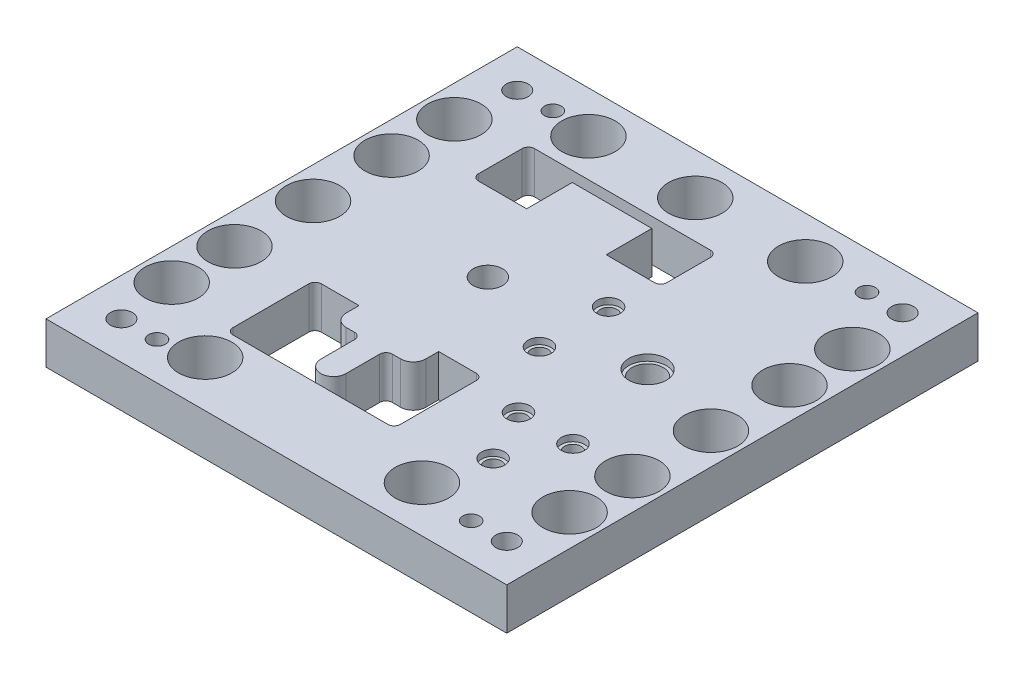
from build123d import *

# Parameters (mm, degrees)
SKETCH1_W                                    = 220
SKETCH1_H                                    = 225
BOSS_EXTRUDE1_DEPTH                          = 20
CUT_EXTRUDE3_REACH                           = 160.607
CUT_EXTRUDE4_REACH                           = 160.607
CUT_EXTRUDE5_REACH                           = 160.607
SKETCH7_R                                    = 4
CUT_EXTRUDE6_REACH                           = 160.607
SKETCH9_R                                    = 7.5
SKETCH10_R                                   = 5.5
CUT_EXTRUDE7_DEPTH                           = 3
SKETCH11_R                                   = 9
CUT_EXTRUDE8_DEPTH                           = 3
CBORE_FOR_M10_HEX_SOCKET_HEAD_CAP_SC_2_COUNT = 2
CBORE_FOR_M10_HEX_SOCKET_HEAD_CAP_SC_2_PITCH = 184
CBORE_FOR_M10_HEX_SOCKET_HEAD_CAP_SC_3_COUNT = 2
CBORE_FOR_M10_HEX_SOCKET_HEAD_CAP_SC_3_PITCH = 263.774524926
CBORE_FOR_M10_HEX_SOCKET_HEAD_CAP_SC_4_COUNT = 2
CBORE_FOR_M10_HEX_SOCKET_HEAD_CAP_SC_4_PITCH = 189
F_8_0MM_DOWEL_HOLE1_D                        = 8
F_25_5_25_5_DIAMETER_HOLE1_D                 = 25.5
CUT_EXTRUDE9_REACH                           = 160.607
SKETCH26_R                                   = 7


with BuildPart() as part:
    # Sketch1 → Boss-Extrude1 (new body)
    with BuildSketch(Plane(origin=(0, 0, 0), x_dir=(1, 0, 0), z_dir=(0, 1, 0))):
        Rectangle(SKETCH1_W, SKETCH1_H)
    extrude(amount=-BOSS_EXTRUDE1_DEPTH)

    # Sketch5 → Cut-Extrude3 (cut, up to next)
    with BuildSketch(Plane(origin=(0, 0, 0), x_dir=(1, 0, 0), z_dir=(0, 1, 0)), mode=Mode.PRIVATE) as cut_extrude3_sk1:
        with BuildLine():
            Line((-2.75, -38.4), (-2.75, -32.27))
            Line((-2.75, -32.27), (15.25, -32.27))
            ThreePointArc((15.25, -32.27), (17.371320344, -33.148679656), (18.25, -35.27))
            Line((18.25, -35.27), (18.25, -71.53))
            ThreePointArc((18.25, -71.53), (17.371320344, -73.651320344), (15.25, -74.53))
            Line((15.25, -74.53), (-58.75, -74.53))
            ThreePointArc((-58.75, -74.53), (-60.871320344, -73.651320344), (-61.75, -71.53))
            Line((-61.75, -71.53), (-61.75, -35.27))
            ThreePointArc((-61.75, -35.27), (-60.871320344, -33.148679656), (-58.75, -32.27))
            Line((-58.75, -32.27), (-40.75, -32.27))
            Line((-40.75, -32.27), (-40.75, -38.4))
            ThreePointArc((-40.75, -38.4), (-38.992640687, -42.642640687), (-34.75, -44.4))
            Line((-34.75, -44.4), (-30.75, -44.4))
            ThreePointArc((-30.75, -44.4), (-28.628679656, -45.278679656), (-27.75, -47.4))
            Line((-27.75, -47.4), (-27.75, -63.53))
            ThreePointArc((-27.75, -63.53), (-21.75, -69.53), (-15.75, -63.53))
            Line((-15.75, -63.53), (-15.75, -47.4))
            ThreePointArc((-15.75, -47.4), (-14.871320344, -45.278679656), (-12.75, -44.4))
            Line((-12.75, -44.4), (-8.75, -44.4))
            ThreePointArc((-8.75, -44.4), (-4.507359313, -42.642640687), (-2.75, -38.4))
        make_face()
    cut_extrude3_tool1 = extrude(cut_extrude3_sk1.sketch, amount=-CUT_EXTRUDE3_REACH, mode=Mode.PRIVATE) & part.part
    add(cut_extrude3_tool1.solids().sort_by_distance((-1.84524, 0, 35.335))[0], mode=Mode.SUBTRACT)

    # Sketch6 → Cut-Extrude4 (cut, up to next)
    with BuildSketch(Plane(origin=(0, 0, 0), x_dir=(1, 0, 0), z_dir=(0, 1, 0)), mode=Mode.PRIVATE) as cut_extrude4_sk1:
        with BuildLine():
            Line((-40.75, 47.73), (-63.75, 47.73))
            ThreePointArc((-63.75, 47.73), (-65.871320344, 48.608679656), (-66.75, 50.73))
            Line((-66.75, 50.73), (-66.75, 71.53))
            ThreePointArc((-66.75, 71.53), (-65.871320344, 73.651320344), (-63.75, 74.53))
            Line((-63.75, 74.53), (20.25, 74.53))
            ThreePointArc((20.25, 74.53), (22.371320344, 73.651320344), (23.25, 71.53))
            Line((23.25, 71.53), (23.25, 50.73))
            ThreePointArc((23.25, 50.73), (22.371320344, 48.608679656), (20.25, 47.73))
            Line((20.25, 47.73), (-2.75, 47.73))
            Line((-2.75, 47.73), (-2.75, 69.53))
            Line((-2.75, 69.53), (-40.75, 69.53))
            Line((-40.75, 69.53), (-40.75, 47.73))
        make_face()
    cut_extrude4_tool1 = extrude(cut_extrude4_sk1.sketch, amount=-CUT_EXTRUDE4_REACH, mode=Mode.PRIVATE) & part.part
    add(cut_extrude4_tool1.solids().sort_by_distance((-52.25, 0, -48.669055))[0], mode=Mode.SUBTRACT)

    # Sketch7 → Cut-Extrude5 (cut, up to next)
    with BuildSketch(Plane(origin=(0, 0, 0), x_dir=(1, 0, 0), z_dir=(0, 1, 0)), mode=Mode.PRIVATE) as cut_extrude5_sk1:
        with Locations((54.5, -63.53)):
            Circle(SKETCH7_R)
    cut_extrude5_tool1 = extrude(cut_extrude5_sk1.sketch, amount=-CUT_EXTRUDE5_REACH, mode=Mode.PRIVATE) & part.part
    # Sketch7 → Cut-Extrude5 (cut, up to next)
    with BuildSketch(Plane(origin=(0, 0, 0), x_dir=(1, 0, 0), z_dir=(0, 1, 0)), mode=Mode.PRIVATE) as cut_extrude5_sk2:
        with Locations((67.5, -38.4)):
            Circle(SKETCH7_R)
    cut_extrude5_tool2 = extrude(cut_extrude5_sk2.sketch, amount=-CUT_EXTRUDE5_REACH, mode=Mode.PRIVATE) & part.part
    # Sketch7 → Cut-Extrude5 (cut, up to next)
    with BuildSketch(Plane(origin=(0, 0, 0), x_dir=(1, 0, 0), z_dir=(0, 1, 0)), mode=Mode.PRIVATE) as cut_extrude5_sk3:
        with Locations((41.5, -38.4)):
            Circle(SKETCH7_R)
    cut_extrude5_tool3 = extrude(cut_extrude5_sk3.sketch, amount=-CUT_EXTRUDE5_REACH, mode=Mode.PRIVATE) & part.part
    # Sketch7 → Cut-Extrude5 (cut, up to next)
    with BuildSketch(Plane(origin=(0, 0, 0), x_dir=(1, 0, 0), z_dir=(0, 1, 0)), mode=Mode.PRIVATE) as cut_extrude5_sk4:
        with Locations((19.38, -6.27)):
            Circle(SKETCH7_R)
    cut_extrude5_tool4 = extrude(cut_extrude5_sk4.sketch, amount=-CUT_EXTRUDE5_REACH, mode=Mode.PRIVATE) & part.part
    # Sketch7 → Cut-Extrude5 (cut, up to next)
    with BuildSketch(Plane(origin=(0, 0, 0), x_dir=(1, 0, 0), z_dir=(0, 1, 0)), mode=Mode.PRIVATE) as cut_extrude5_sk5:
        with Locations((19.38, 26.73)):
            Circle(SKETCH7_R)
    cut_extrude5_tool5 = extrude(cut_extrude5_sk5.sketch, amount=-CUT_EXTRUDE5_REACH, mode=Mode.PRIVATE) & part.part
    add(cut_extrude5_tool1.solids().sort_by_distance((54.5, 0, 63.53))[0], mode=Mode.SUBTRACT)
    add(cut_extrude5_tool2.solids().sort_by_distance((67.5, 0, 38.4))[0], mode=Mode.SUBTRACT)
    add(cut_extrude5_tool3.solids().sort_by_distance((41.5, 0, 38.4))[0], mode=Mode.SUBTRACT)
    add(cut_extrude5_tool4.solids().sort_by_distance((19.38, 0, 6.27))[0], mode=Mode.SUBTRACT)
    add(cut_extrude5_tool5.solids().sort_by_distance((19.38, 0, -26.73))[0], mode=Mode.SUBTRACT)

    # Sketch9 → Cut-Extrude6 (cut, up to next)
    with BuildSketch(Plane(origin=(0, 0, 0), x_dir=(1, 0, 0), z_dir=(0, 1, 0)), mode=Mode.PRIVATE) as cut_extrude6_sk1:
        with Locations((54.5, 10.23)):
            Circle(SKETCH9_R)
    cut_extrude6_tool1 = extrude(cut_extrude6_sk1.sketch, amount=-CUT_EXTRUDE6_REACH, mode=Mode.PRIVATE) & part.part
    add(cut_extrude6_tool1.solids().sort_by_distance((54.5, 0, -10.23))[0], mode=Mode.SUBTRACT)

    # Sketch10 → Cut-Extrude7 (cut)
    with BuildSketch(Plane(origin=(0, 0, 0), x_dir=(1, 0, 0), z_dir=(0, 1, 0))):
        with Locations((19.38, 26.73)):
            Circle(SKETCH10_R)
        with Locations((19.38, -6.27)):
            Circle(SKETCH10_R)
        with Locations((41.5, -38.4)):
            Circle(SKETCH10_R)
        with Locations((67.5, -38.4)):
            Circle(SKETCH10_R)
        with Locations((54.5, -63.53)):
            Circle(SKETCH10_R)
    extrude(amount=-CUT_EXTRUDE7_DEPTH, mode=Mode.SUBTRACT)

    # Sketch11 → Cut-Extrude8 (cut)
    with BuildSketch(Plane(origin=(0, 0, 0), x_dir=(1, 0, 0), z_dir=(0, 1, 0))):
        with Locations((54.5, 10.23)):
            Circle(SKETCH11_R)
    extrude(amount=-CUT_EXTRUDE8_DEPTH, mode=Mode.SUBTRACT)

    # Sketch16 → CBORE for M10 Hex Socket Head Cap Screw1 (revolve, cut)
    with BuildSketch(Plane(origin=(92, -20, -94.5), x_dir=(0, 0, -1), z_dir=(1, 0, 0))):
        Polygon((0, 0), (0, 20), (5.25, 20), (5.25, 10.6), (9, 10.6), (9, 0.025), (9.025, 0), align=None)
    cbore_for_m10_hex_socket_head_cap_screw1 = revolve(axis=Axis((92, -26.35, -94.5), (0, 1, 0)), mode=Mode.SUBTRACT)

    # CBORE for M10 Hex Socket Head Cap Sc 2: CBORE for M10 Hex Socket Head Cap Screw1 ×2
    with Locations(*[(-i * CBORE_FOR_M10_HEX_SOCKET_HEAD_CAP_SC_2_PITCH, 0, 0) for i in range(1, CBORE_FOR_M10_HEX_SOCKET_HEAD_CAP_SC_2_COUNT)]):
        add(cbore_for_m10_hex_socket_head_cap_screw1, mode=Mode.SUBTRACT)

    # CBORE for M10 Hex Socket Head Cap Sc 3: CBORE for M10 Hex Socket Head Cap Screw1 ×2
    with Locations(*[Vector(-0.6975654682783963, 0, 0.7165210516555266) * (i * CBORE_FOR_M10_HEX_SOCKET_HEAD_CAP_SC_3_PITCH) for i in range(1, CBORE_FOR_M10_HEX_SOCKET_HEAD_CAP_SC_3_COUNT)]):
        add(cbore_for_m10_hex_socket_head_cap_screw1, mode=Mode.SUBTRACT)

    # CBORE for M10 Hex Socket Head Cap Sc 4: CBORE for M10 Hex Socket Head Cap Screw1 ×2
    with Locations(*[(0, 0, i * CBORE_FOR_M10_HEX_SOCKET_HEAD_CAP_SC_4_PITCH) for i in range(1, CBORE_FOR_M10_HEX_SOCKET_HEAD_CAP_SC_4_COUNT)]):
        add(cbore_for_m10_hex_socket_head_cap_screw1, mode=Mode.SUBTRACT)

    # Ø8.0mm Dowel Hole1 (through all)
    with Locations(Plane(origin=(0, -20, 0), x_dir=(-1, 0, 0), z_dir=(0, -1, 0))):
        with Locations((-75, 94.5), (75, 94.5), (75, -94.5), (-75, -94.5)):
            Hole(F_8_0MM_DOWEL_HOLE1_D / 2)

    # Ø25.5 (25.5) Diameter Hole1 (through all)
    with Locations(Plane(origin=(0, 0, 0), x_dir=(1, 0, 0), z_dir=(0, 1, 0))):
        with Locations((-56, 92.5), (-5, 92.5), (47.5, 92.5), (95, 67.5), (95, 37.5), (95, 0), (95, -37.5), (95, -67.5), (47.5, -90.5), (-56, -90.5), (-95, -67.5), (-95, -37.5), (-95, 0), (-95, 67.5), (-95, 37.5)):
            Hole(F_25_5_25_5_DIAMETER_HOLE1_D / 2)

    # Sketch26 → Cut-Extrude9 (cut, up to next)
    with BuildSketch(Plane(origin=(0, 0, 0), x_dir=(1, 0, 0), z_dir=(0, 1, 0)), mode=Mode.PRIVATE) as cut_extrude9_sk1:
        with Locations((-21.75, 10.23)):
            Circle(SKETCH26_R)
    cut_extrude9_tool1 = extrude(cut_extrude9_sk1.sketch, amount=-CUT_EXTRUDE9_REACH, mode=Mode.PRIVATE) & part.part
    add(cut_extrude9_tool1.solids().sort_by_distance((-21.75, 0, -10.23))[0], mode=Mode.SUBTRACT)


solid = part.part
